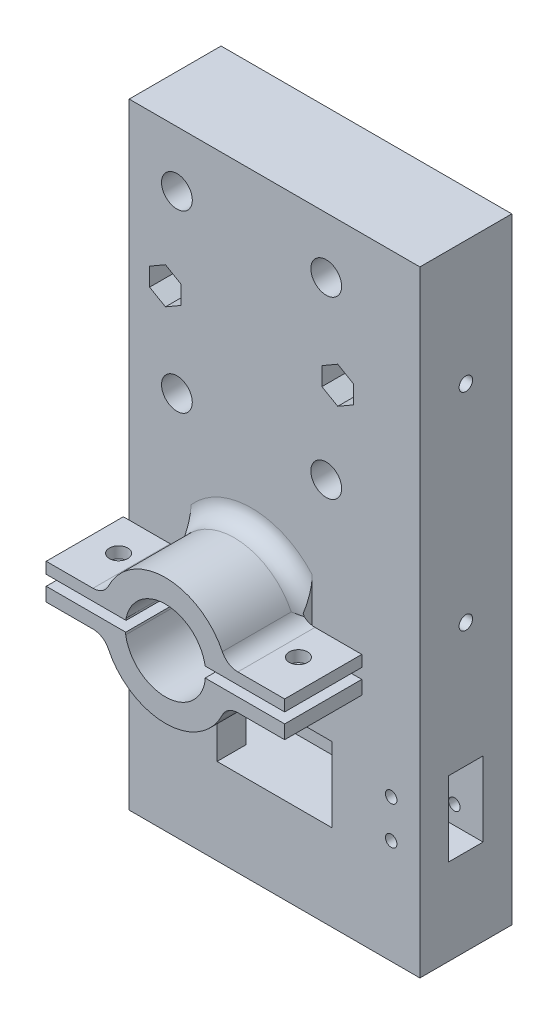
from build123d import *

# Parameters (mm, degrees)
SKETCH1_W               = 42.62295082
SKETCH1_H               = 50
SKETCH1_R               = 2.677018134
BOSS_EXTRUDE1_DEPTH     = 16
SKETCH2_R               = 11.04
CUT_EXTRUDE2_DEPTH      = 11
SKETCH3_R               = 1.75
CUT_EXTRUDE3_DEPTH      = 10
CUT_EXTRUDE6_START      = -5
CUT_EXTRUDE6_DEPTH      = 32.540101042
SKETCH30_W              = 42.62295082
SKETCH30_H              = 16
BOSS_EXTRUDE8_DEPTH     = 20.23
SKETCH10_W              = 42.62295082
SKETCH10_H              = 22
BOSS_EXTRUDE2_DEPTH     = 16
SKETCH14_W              = 6
SKETCH14_H              = 13
CUT_EXTRUDE7_DEPTH      = 82.194758677
BOSS_EXTRUDE3_DEPTH     = 8
CUT_EXTRUDE9_DEPTH      = 8
SKETCH18_W              = 0.9
SKETCH18_H              = 4
SKETCH18_W_2            = 1.8
CUT_EXTRUDE10_DEPTH     = 10.2
CUT_EXTRUDE8_DEPTH      = 76.066873458
CUT_EXTRUDE8_DEPTH_BACK = 76.066873458
SKETCH15_R              = 1
CUT_EXTRUDE5_DEPTH      = 86.979971451
CUT_EXTRUDE5_DEPTH_BACK = 50
SKETCH6_W               = 9.034037672
SKETCH6_H               = 3.85
SKETCH20_W              = 8
SKETCH20_H              = 16
BOSS_EXTRUDE5_DEPTH     = 13
SKETCH21_W              = 8
SKETCH21_H              = 6
CUT_EXTRUDE11_DEPTH     = 13
SKETCH22_R              = 1
CUT_EXTRUDE12_DEPTH     = 76.066873458
SKETCH24_W              = 50.62295082
SKETCH24_H              = 5
BOSS_EXTRUDE6_DEPTH     = 15
SKETCH25_W              = 50.62295082
SKETCH25_H              = 15
BOSS_EXTRUDE7_DEPTH     = 11
SKETCH26_R              = 1
CUT_EXTRUDE13_DEPTH     = 10
SKETCH27_W              = 4
SKETCH27_H              = 1.8
CUT_EXTRUDE14_DEPTH     = 10.2
SKETCH29_W              = 20
SKETCH29_H              = 3.2
CUT_EXTRUDE15_DEPTH     = 5
SKETCH31_W              = 9
SKETCH31_H              = 6
CUT_EXTRUDE16_DEPTH     = 11
BOSS_EXTRUDE9_DEPTH     = 15
SKETCH35_R              = 7.01
CUT_EXTRUDE17_DEPTH     = 89.752101331
SKETCH46_R              = 1.6
CUT_EXTRUDE29_DEPTH     = 116.405526257
SKETCH47_W              = 10.199129155
SKETCH47_H              = 1.570077555
CUT_EXTRUDE30_DEPTH     = 93.638736448
FILLET1_R               = 3
FILLET2_R               = 3


with BuildPart() as part:
    # Sketch1 → Boss-Extrude1 (new body)
    with BuildSketch(Plane.XY):
        Rectangle(SKETCH1_W, SKETCH1_H)
        with Locations((-13, -15.25)):
            Circle(SKETCH1_R, mode=Mode.SUBTRACT)
        with Locations(Location((13, -15.25, 0), (0, 0, 180))):
            Circle(SKETCH1_R, mode=Mode.SUBTRACT)
        with Locations((13, 15.25)):
            Circle(SKETCH1_R, mode=Mode.SUBTRACT)
        with Locations(Location((-13, 15.25, 0), (0, 0, 180))):
            Circle(SKETCH1_R, mode=Mode.SUBTRACT)
    extrude(amount=BOSS_EXTRUDE1_DEPTH)

    # Sketch2 → Cut-Extrude2 (cut)
    with BuildSketch(Plane.XY):
        Circle(SKETCH2_R)
    extrude(amount=CUT_EXTRUDE2_DEPTH, mode=Mode.SUBTRACT)

    # Sketch3 → Cut-Extrude3 (cut)
    with BuildSketch(Plane(origin=(0, 0, 0), x_dir=(-1, 0, 0), z_dir=(0, 0, -1))):
        with Locations((-15, 0)):
            Circle(SKETCH3_R)
        with Locations(Location((15, 0, 0), (0, 0, 180))):
            Circle(SKETCH3_R)
    extrude(amount=-CUT_EXTRUDE3_DEPTH, mode=Mode.SUBTRACT)

    # Sketch9 → Cut-Extrude6 (cut, through all)
    with BuildSketch(Plane(origin=(0, 0, 0), x_dir=(-1, 0, 0), z_dir=(0, 0, -1)).offset(CUT_EXTRUDE6_START)):
        Polygon((-15, 3.175426481), (-17.75, 1.58771324), (-17.75, -1.58771324), (-15, -3.175426481), (-12.25, -1.58771324), (-12.25, 1.58771324), align=None)
        Polygon((12.25, 1.58771324), (15, 3.175426481), (17.75, 1.58771324), (17.75, -1.58771324), (15, -3.175426481), (12.25, -1.58771324), align=None)
    extrude(amount=-CUT_EXTRUDE6_DEPTH, mode=Mode.SUBTRACT)

    # Sketch30 → Boss-Extrude8 (add)
    with BuildSketch(Plane.XZ.offset(25)):
        with Locations((0, 8)):
            Rectangle(SKETCH30_W, SKETCH30_H)
    extrude(amount=BOSS_EXTRUDE8_DEPTH)

    # Sketch10 → Boss-Extrude2 (add)
    with BuildSketch(Plane.XY):
        with Locations((0, -56.23)):
            Rectangle(SKETCH10_W, SKETCH10_H)
    extrude(amount=BOSS_EXTRUDE2_DEPTH)

    # Sketch14 → Cut-Extrude7 (cut, through all)
    with BuildSketch(Plane.ZY.offset(21.31147541)):
        with Locations((8, -60.73)):
            Rectangle(SKETCH14_W, SKETCH14_H)
    extrude(amount=-CUT_EXTRUDE7_DEPTH, mode=Mode.SUBTRACT)

    # Sketch16 → Boss-Extrude3 (add)
    with BuildSketch(Plane(origin=(21.31147541, 0, 0), x_dir=(0, 0, -1), z_dir=(1, 0, 0))):
        Polygon((-11, -54.23), (-8, -54.23), (-8, 25), (-16, 25), (-16, -54.23), align=None)
        Polygon((-8, 25), (-8, -54.23), (-5, -54.23), (0, -54.23), (0, 25), align=None)
    extrude(amount=BOSS_EXTRUDE3_DEPTH)

    # Sketch17 → Cut-Extrude9 (cut)
    with BuildSketch(Plane(origin=(29.31147541, 0, 0), x_dir=(0, 0, -1), z_dir=(1, 0, 0))):
        with BuildLine():
            ThreePointArc((-8, 4.56), (-9.175, 3.385), (-8, 2.21))
            Line((-8, 2.21), (-8, 4.56))
        make_face()
        with BuildLine():
            Line((-8, 4.56), (-8, 2.21))
            ThreePointArc((-8, 2.21), (-7.169149532, 2.554149532), (-6.825, 3.385))
            ThreePointArc((-6.825, 3.385), (-7.169149532, 4.215850468), (-8, 4.56))
        make_face()
        with BuildLine():
            ThreePointArc((-8, -31.44), (-9.175, -32.615), (-8, -33.79))
            Line((-8, -33.79), (-8, -31.44))
        make_face()
        with BuildLine():
            Line((-8, -31.44), (-8, -33.79))
            ThreePointArc((-8, -33.79), (-7.169149532, -33.445850468), (-6.825, -32.615))
            ThreePointArc((-6.825, -32.615), (-7.169149532, -31.784149532), (-8, -31.44))
        make_face()
    extrude(amount=-CUT_EXTRUDE9_DEPTH, mode=Mode.SUBTRACT)

    # Sketch18 → Cut-Extrude10 (cut)
    with BuildSketch(Plane(origin=(0, 0, 0), x_dir=(-1, 0, 0), z_dir=(0, 0, -1))):
        with Locations((-24.86147541, 3.385)):
            Rectangle(SKETCH18_W, SKETCH18_H)
        with Locations((-25.76147541, 3.385)):
            Rectangle(SKETCH18_W, SKETCH18_H)
        with Locations((-25.31147541, -32.615)):
            Rectangle(SKETCH18_W_2, SKETCH18_H)
    extrude(amount=-CUT_EXTRUDE10_DEPTH, mode=Mode.SUBTRACT)

    # Sketch15 → Cut-Extrude8 (cut, two sides: drawn at the far end of the back side and taken through both)
    with BuildSketch(Plane(origin=(0, 0, 0), x_dir=(-1, 0, 0), z_dir=(0, 0, -1)).offset(-CUT_EXTRUDE8_DEPTH_BACK)):
        with Locations(Location((16.31147541, -64.03, 0), (0, 0, 270))):
            Circle(SKETCH15_R)
        with Locations((16.31147541, -57.43)):
            Circle(SKETCH15_R)
    extrude(amount=CUT_EXTRUDE8_DEPTH + CUT_EXTRUDE8_DEPTH_BACK, mode=Mode.SUBTRACT)

    # Sketch6 → Cut-Extrude5 (cut, two sides: drawn at the far end of the back side and taken through both)
    with BuildSketch(Plane.XZ.offset(54.23).offset(-CUT_EXTRUDE5_DEPTH_BACK)):
        with Locations((0, 12.925)):
            Rectangle(SKETCH6_W, SKETCH6_H)
    extrude(amount=CUT_EXTRUDE5_DEPTH + CUT_EXTRUDE5_DEPTH_BACK, mode=Mode.SUBTRACT)

    # Sketch20 → Boss-Extrude5 (add)
    with BuildSketch(Plane(origin=(0, -54.23, 0), x_dir=(-1, 0, 0), z_dir=(0, -1, 0))):
        with Locations((-25.31147541, -8)):
            Rectangle(SKETCH20_W, SKETCH20_H)
    extrude(amount=BOSS_EXTRUDE5_DEPTH)

    # Sketch21 → Cut-Extrude11 (cut)
    with BuildSketch(Plane(origin=(0, -67.23, 0), x_dir=(-1, 0, 0), z_dir=(0, -1, 0))):
        with Locations((-25.31147541, -8)):
            Rectangle(SKETCH21_W, SKETCH21_H)
    extrude(amount=-CUT_EXTRUDE11_DEPTH, mode=Mode.SUBTRACT)

    # Sketch22 → Cut-Extrude12 (cut, through all)
    with BuildSketch(Plane(origin=(0, 0, 0), x_dir=(-1, 0, 0), z_dir=(0, 0, -1))):
        with Locations((-24.31147541, -64.03)):
            Circle(SKETCH22_R)
        with Locations((-24.31147541, -57.43)):
            Circle(SKETCH22_R)
    extrude(amount=-CUT_EXTRUDE12_DEPTH, mode=Mode.SUBTRACT)

    # Sketch24 → Boss-Extrude6 (add)
    with BuildSketch(Plane.XZ.offset(67.23)):
        with Locations((4, 2.5)):
            Rectangle(SKETCH24_W, SKETCH24_H)
    extrude(amount=BOSS_EXTRUDE6_DEPTH)

    # Sketch25 → Boss-Extrude7 (add)
    with BuildSketch(Plane.XY.offset(5)):
        with Locations((4, -74.73)):
            Rectangle(SKETCH25_W, SKETCH25_H)
    extrude(amount=BOSS_EXTRUDE7_DEPTH)

    # Sketch26 → Cut-Extrude13 (cut)
    with BuildSketch(Plane.XZ.offset(82.23)):
        with BuildLine():
            ThreePointArc((-15, 8), (-14, 7), (-13, 8))
            Line((-13, 8), (-15, 8))
        make_face()
        with BuildLine():
            Line((-15, 8), (-13, 8))
            ThreePointArc((-13, 8), (-14, 9), (-15, 8))
        make_face()
        with Locations(Location((22, 8, 0), (0, 0, 270))):
            Circle(SKETCH26_R)
    extrude(amount=-CUT_EXTRUDE13_DEPTH, mode=Mode.SUBTRACT)

    # Sketch27 → Cut-Extrude14 (cut)
    with BuildSketch(Plane(origin=(0, 0, 0), x_dir=(-1, 0, 0), z_dir=(0, 0, -1))):
        with Locations((-22.00147541, -78.23)):
            Rectangle(SKETCH27_W, SKETCH27_H)
        with Locations((14.00147541, -78.23)):
            Rectangle(SKETCH27_W, SKETCH27_H)
    extrude(amount=-CUT_EXTRUDE14_DEPTH, mode=Mode.SUBTRACT)

    # Sketch29 → Cut-Extrude15 (cut)
    with BuildSketch(Plane.XY.offset(16)):
        with Locations((4, -55.83)):
            Rectangle(SKETCH29_W, SKETCH29_H)
        Polygon((-6, -57.43), (-6, -59.105302663), (4, -60.73), (14, -59.105302663), (14, -57.43), align=None)
        Polygon((4, -60.73), (-6, -59.105302663), (-6, -62.354697337), align=None)
        with Locations((4, -65.63)):
            Rectangle(SKETCH29_W, SKETCH29_H)
        Polygon((14, -62.354697337), (4, -60.73), (-6, -62.354697337), (-6, -64.03), (14, -64.03), align=None)
        Polygon((14, -59.105302663), (4, -60.73), (14, -62.354697337), align=None)
    extrude(amount=-CUT_EXTRUDE15_DEPTH, mode=Mode.SUBTRACT)

    # Sketch31 → Cut-Extrude16 (cut)
    with BuildSketch(Plane(origin=(0, 0, 0), x_dir=(-1, 0, 0), z_dir=(0, 0, -1))):
        with Locations((0, 11.04)):
            Rectangle(SKETCH31_W, SKETCH31_H)
        with Locations((0, -11.04)):
            Rectangle(SKETCH31_W, SKETCH31_H)
    extrude(amount=-CUT_EXTRUDE16_DEPTH, mode=Mode.SUBTRACT)

    # Sketch32 → Boss-Extrude9 (add)
    with BuildSketch(Plane.XY.offset(16)):
        with BuildLine():
            Line((10.560909988, -36.923121675), (20.760039143, -36.923121675))
            Line((20.760039143, -36.923121675), (20.760039143, -38.888788684))
            Line((20.760039143, -38.888788684), (18.351282885, -38.888788684))
            Line((18.351282885, -38.888788684), (6.860712608, -38.888788684))
            Line((6.860712608, -38.888788684), (6.851282885, -38.564756874))
            ThreePointArc((6.851282885, -38.564756874), (0, -33), (-6.851282885, -38.564756874))
            Line((-6.851282885, -38.564756874), (-6.851282885, -38.888788684))
            Line((-6.851282885, -38.888788684), (-18.351282885, -38.888788684))
            Line((-18.351282885, -38.888788684), (-20.760039143, -38.888788684))
            Line((-20.760039143, -38.888788684), (-20.760039143, -36.923121675))
            Line((-20.760039143, -36.923121675), (-10.560909988, -36.923121675))
            ThreePointArc((-10.560909988, -36.923121675), (0, -29), (10.560909988, -36.923121675))
        make_face()
        with BuildLine():
            Line((-18.351282885, -40.691776253), (-6.913181756, -40.691776253))
            Line((-6.913181756, -40.691776253), (-6.913181756, -41.099053236))
            ThreePointArc((-6.913181756, -41.099053236), (0, -47), (6.913181756, -41.099053236))
            Line((6.913181756, -41.099053236), (6.913181756, -40.691776253))
            Line((6.913181756, -40.691776253), (18.351282885, -40.691776253))
            Line((18.351282885, -40.691776253), (20.760039143, -40.691776253))
            Line((20.760039143, -40.691776253), (20.760039143, -43.076878325))
            Line((20.760039143, -43.076878325), (10.560909988, -43.076878325))
            ThreePointArc((10.560909988, -43.076878325), (0, -51), (-10.560909988, -43.076878325))
            Line((-10.560909988, -43.076878325), (-20.760039143, -43.076878325))
            Line((-20.760039143, -43.076878325), (-20.760039143, -40.691776253))
            Line((-20.760039143, -40.691776253), (-18.351282885, -40.691776253))
        make_face()
    extrude(amount=BOSS_EXTRUDE9_DEPTH)

    # Sketch35 → Cut-Extrude17 (cut, through all)
    with BuildSketch(Plane.XY.offset(16)):
        with Locations((0, -40)):
            Circle(SKETCH35_R)
    extrude(amount=-CUT_EXTRUDE17_DEPTH, mode=Mode.SUBTRACT)

    # Sketch46 → Cut-Extrude29 (cut, through all)
    with BuildSketch(Plane.XZ.offset(82.23)):
        with Locations(Location((-15.660039143, 23.5, 0), (0, 0, 270))):
            Circle(SKETCH46_R)
        with Locations(Location((15.660039143, 23.5, 0), (0, 0, 270))):
            Circle(SKETCH46_R)
    extrude(amount=-CUT_EXTRUDE29_DEPTH, mode=Mode.SUBTRACT)

    # Sketch47 → Cut-Extrude30 (cut, through all)
    with BuildSketch(Plane(origin=(0, 0, 0), x_dir=(1, 0, 0), z_dir=(0, 1, 0))):
        with Locations((-15.660474565, -16.785038777)):
            Rectangle(SKETCH47_W, SKETCH47_H)
        with Locations((15.660474565, -16.785038777)):
            Rectangle(SKETCH47_W, SKETCH47_H)
    extrude(amount=-CUT_EXTRUDE30_DEPTH, mode=Mode.SUBTRACT)

    # Fillet1
    # the kernel refuses this fillet: 3 mm, written as the material it adds along each edge
    with BuildSketch(Plane(origin=(0, -40, 16), x_dir=(0.9214282650932413, 0.3885485198623971, 0), z_dir=(-0.3885485198623971, 0.9214282650932413, 0))) as fillet1_piece_1_section:
        with BuildLine():
            CenterArc((11 + FILLET1_R, -FILLET1_R), FILLET1_R, 90, 90)
            Line((11, -FILLET1_R), (11, 0))
            Line((11, 0), (11 + FILLET1_R, 0))
        make_face()
    fillet1_piece_1 = revolve(axis=Axis((0, -40, 16), (0, 0, -1)), revolution_arc=225.72842835, mode=Mode.PRIVATE)
    fillet1_piece_1 = split(fillet1_piece_1, bisect_by=Plane(origin=(-10.560909988, -40, 16), z_dir=(1, 0, 0)), keep=Keep.TOP, mode=Mode.PRIVATE)
    fillet1_piece_1 = split(fillet1_piece_1, bisect_by=Plane(origin=(10.560909988, -40, 16), z_dir=(-1, 0, 0)), keep=Keep.TOP, mode=Mode.PRIVATE)
    add(fillet1_piece_1)
    with BuildSketch(Plane(origin=(0, -40, 16), x_dir=(0.9214282650932413, 0.3885485198623971, 0), z_dir=(-0.3885485198623971, 0.9214282650932413, 0))) as fillet1_piece_2_section:
        with BuildLine():
            CenterArc((11 + FILLET1_R, -FILLET1_R), FILLET1_R, 90, 90)
            Line((11, -FILLET1_R), (11, 0))
            Line((11, 0), (11 + FILLET1_R, 0))
        make_face()
    fillet1_piece_2 = revolve(axis=Axis((0, -40, 16), (0, 0, -1)), revolution_arc=225.72842835, mode=Mode.PRIVATE)
    fillet1_piece_2 = split(fillet1_piece_2, bisect_by=Plane(origin=(0, -40, 17.570077555), z_dir=(0, 0, 1)), keep=Keep.TOP, mode=Mode.PRIVATE)
    fillet1_piece_2 = split(fillet1_piece_2, bisect_by=Plane(origin=(0, -38.888788684, 16), z_dir=(0, 1, 0)), keep=Keep.TOP, mode=Mode.PRIVATE)
    add(fillet1_piece_2)
    with BuildSketch(Plane(origin=(0, -40, 16), x_dir=(0.9214282650932413, 0.3885485198623971, 0), z_dir=(-0.3885485198623971, 0.9214282650932413, 0))) as fillet1_piece_3_section:
        with BuildLine():
            CenterArc((11 + FILLET1_R, -FILLET1_R), FILLET1_R, 90, 90)
            Line((11, -FILLET1_R), (11, 0))
            Line((11, 0), (11 + FILLET1_R, 0))
        make_face()
    fillet1_piece_3 = revolve(axis=Axis((0, -40, 16), (0, 0, -1)), revolution_arc=225.72842835, mode=Mode.PRIVATE)
    fillet1_piece_3 = split(fillet1_piece_3, bisect_by=Plane(origin=(0, -40, 17.570077555), z_dir=(0, 0, 1)), keep=Keep.TOP, mode=Mode.PRIVATE)
    fillet1_piece_3 = split(fillet1_piece_3, bisect_by=Plane(origin=(0, -43.076878325, 16), z_dir=(0, -1, 0)), keep=Keep.TOP, mode=Mode.PRIVATE)
    add(fillet1_piece_3)
    with BuildSketch(Plane(origin=(0, -40, 16), x_dir=(-0.9214282650932415, -0.3885485198623964, 0), z_dir=(0.3885485198623964, -0.9214282650932415, 0))) as fillet1_piece_4_section:
        with BuildLine():
            CenterArc((11 + FILLET1_R, -FILLET1_R), FILLET1_R, 90, 90)
            Line((11, -FILLET1_R), (11, 0))
            Line((11, 0), (11 + FILLET1_R, 0))
        make_face()
    fillet1_piece_4 = revolve(axis=Axis((0, -40, 16), (0, 0, -1)), revolution_arc=225.72842835, mode=Mode.PRIVATE)
    fillet1_piece_4 = split(fillet1_piece_4, bisect_by=Plane(origin=(-10.560909988, -40, 16), z_dir=(1, 0, 0)), keep=Keep.TOP, mode=Mode.PRIVATE)
    fillet1_piece_4 = split(fillet1_piece_4, bisect_by=Plane(origin=(10.560909988, -40, 16), z_dir=(-1, 0, 0)), keep=Keep.TOP, mode=Mode.PRIVATE)
    add(fillet1_piece_4)
    with BuildSketch(Plane(origin=(0, -40, 16), x_dir=(-0.9214282650932415, -0.3885485198623964, 0), z_dir=(0.3885485198623964, -0.9214282650932415, 0))) as fillet1_piece_5_section:
        with BuildLine():
            CenterArc((11 + FILLET1_R, -FILLET1_R), FILLET1_R, 90, 90)
            Line((11, -FILLET1_R), (11, 0))
            Line((11, 0), (11 + FILLET1_R, 0))
        make_face()
    fillet1_piece_5 = revolve(axis=Axis((0, -40, 16), (0, 0, -1)), revolution_arc=225.72842835, mode=Mode.PRIVATE)
    fillet1_piece_5 = split(fillet1_piece_5, bisect_by=Plane(origin=(0, -40, 17.570077555), z_dir=(0, 0, 1)), keep=Keep.TOP, mode=Mode.PRIVATE)
    fillet1_piece_5 = split(fillet1_piece_5, bisect_by=Plane(origin=(0, -43.076878325, 16), z_dir=(0, -1, 0)), keep=Keep.TOP, mode=Mode.PRIVATE)
    add(fillet1_piece_5)
    with BuildSketch(Plane(origin=(0, -40, 16), x_dir=(-0.9214282650932415, -0.3885485198623964, 0), z_dir=(0.3885485198623964, -0.9214282650932415, 0))) as fillet1_piece_6_section:
        with BuildLine():
            CenterArc((11 + FILLET1_R, -FILLET1_R), FILLET1_R, 90, 90)
            Line((11, -FILLET1_R), (11, 0))
            Line((11, 0), (11 + FILLET1_R, 0))
        make_face()
    fillet1_piece_6 = revolve(axis=Axis((0, -40, 16), (0, 0, -1)), revolution_arc=225.72842835, mode=Mode.PRIVATE)
    fillet1_piece_6 = split(fillet1_piece_6, bisect_by=Plane(origin=(0, -40, 17.570077555), z_dir=(0, 0, 1)), keep=Keep.TOP, mode=Mode.PRIVATE)
    fillet1_piece_6 = split(fillet1_piece_6, bisect_by=Plane(origin=(0, -38.888788684, 16), z_dir=(0, 1, 0)), keep=Keep.TOP, mode=Mode.PRIVATE)
    add(fillet1_piece_6)

    # Fillet2
    # the kernel refuses this fillet: 3 mm, written as the material it adds along each edge
    with BuildSketch(Plane(origin=(-10.560909988, -43.076878325, 13.871382398), x_dir=(0.3581148689909804, -0.9336775356661275, 0), z_dir=(0, 0, 1))) as fillet2_piece_1_section:
        with BuildLine():
            CenterArc((2.066378919, -2.989734625), FILLET2_R, 94.741200672, 64.274330602)
            Line((-0.734653688, -1.915390018), (0, 0))
            ThreePointArc((0, 0), (0.909206724, -0.03763971), (1.818413448, 0))
        make_face()
    fillet2_piece_1 = extrude(amount=17.128617602, mode=Mode.PRIVATE)
    fillet2_piece_1 = split(fillet2_piece_1, bisect_by=Plane(origin=(-10.560909988, -43.076878325, 17.570077555), z_dir=(0, 0, 1)), keep=Keep.TOP, mode=Mode.PRIVATE)
    add(fillet2_piece_1)
    with BuildSketch(Plane(origin=(-10.560909988, -36.923121675, 13.871382398), x_dir=(-1, 0, 0), z_dir=(0, 0, 1))) as fillet2_piece_2_section:
        with BuildLine():
            CenterArc((2.051447041, -3), FILLET2_R, 90, 64.274330602)
            ThreePointArc((-0.651200894, -1.697811787), (-0.290457095, -0.862385233), (0, 0))
            Line((0, 0), (2.051447041, 0))
        make_face()
    fillet2_piece_2 = extrude(amount=17.128617602, mode=Mode.PRIVATE)
    fillet2_piece_2 = split(fillet2_piece_2, bisect_by=Plane(origin=(-10.560909988, -36.923121675, 17.570077555), z_dir=(0, 0, 1)), keep=Keep.TOP, mode=Mode.PRIVATE)
    add(fillet2_piece_2)
    with BuildSketch(Plane(origin=(10.560909988, -36.923121675, 13.871382398), x_dir=(-0.3581148689909838, 0.9336775356661263, 0), z_dir=(0, 0, 1))) as fillet2_piece_3_section:
        with BuildLine():
            CenterArc((2.066378919, -2.989734625), FILLET2_R, 94.741200672, 64.274330602)
            Line((-0.734653688, -1.915390018), (0, 0))
            ThreePointArc((0, 0), (0.909206724, -0.03763971), (1.818413448, 0))
        make_face()
    fillet2_piece_3 = extrude(amount=17.128617602, mode=Mode.PRIVATE)
    fillet2_piece_3 = split(fillet2_piece_3, bisect_by=Plane(origin=(10.560909988, -36.923121675, 17.570077555), z_dir=(0, 0, 1)), keep=Keep.TOP, mode=Mode.PRIVATE)
    add(fillet2_piece_3)
    with BuildSketch(Plane(origin=(10.560909988, -43.076878325, 13.871382398), x_dir=(1, 0, 0), z_dir=(0, 0, 1))) as fillet2_piece_4_section:
        with BuildLine():
            CenterArc((2.051447041, -3), FILLET2_R, 90, 64.274330602)
            ThreePointArc((-0.651200894, -1.697811787), (-0.290457095, -0.862385233), (0, 0))
            Line((0, 0), (2.051447041, 0))
        make_face()
    fillet2_piece_4 = extrude(amount=17.128617602, mode=Mode.PRIVATE)
    fillet2_piece_4 = split(fillet2_piece_4, bisect_by=Plane(origin=(10.560909988, -43.076878325, 17.570077555), z_dir=(0, 0, 1)), keep=Keep.TOP, mode=Mode.PRIVATE)
    add(fillet2_piece_4)


solid = part.part
